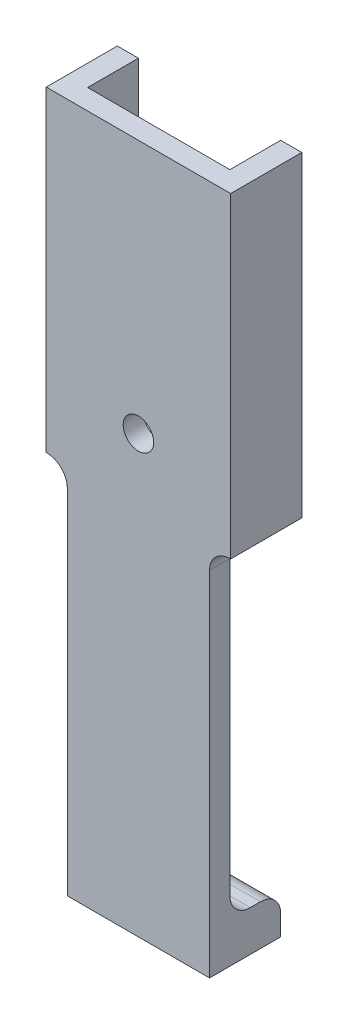
from build123d import *

# Parameters (mm, degrees)
SKETCH2_W                       = 14
SKETCH2_H                       = 31
SKETCH2_R                       = 1.5
SKETCH2_H_2                     = 36.9
BOSS_EXTRUDE1_DEPTH             = 2
SKETCH3_W                       = 14
SKETCH3_H                       = 4
BOSS_EXTRUDE2_DEPTH             = 5
SKETCH4_R                       = 1
CUT_EXTRUDE1_DEPTH              = 4
SKETCH5_W                       = 0.075
SKETCH5_H                       = 31
SKETCH5_H_2                     = 0.15
BOSS_EXTRUDE3_DEPTH             = 5
BOSS_EXTRUDE3_DIRECTION_2_REACH = 55.101
FILLET1_R                       = 2


with BuildPart() as part:
    # Sketch2 → Boss-Extrude1 (new body)
    # profile 1 of 3: a face of its own
    with BuildSketch(Plane.XY):
        Rectangle(SKETCH2_W, SKETCH2_H)
        with BuildLine():
            ThreePointArc((1.7, -9.5), (0, -11.2), (-1.7, -9.5))
            ThreePointArc((-1.7, -9.5), (0, -7.8), (1.7, -9.5))
        make_face(mode=Mode.SUBTRACT)
    # profile 2 of 3: a face of its own
    with BuildSketch(Plane.XY):
        with BuildLine():
            ThreePointArc((-1.7, -9.5), (0, -7.8), (1.7, -9.5))
            ThreePointArc((1.7, -9.5), (0, -11.2), (-1.7, -9.5))
        make_face()
        with Locations((0, -9.5)):
            Circle(SKETCH2_R, mode=Mode.SUBTRACT)
    # profile 3 of 3: a face of its own
    with BuildSketch(Plane.XY):
        with Locations((0, -33.95)):
            Rectangle(SKETCH2_W, SKETCH2_H_2)
    extrude(amount=BOSS_EXTRUDE1_DEPTH)

    # Sketch3 → Boss-Extrude2 (add)
    with BuildSketch(Plane(origin=(0, 0, 0), x_dir=(-1, 0, 0), z_dir=(0, 0, -1))):
        with Locations((0, -50.4)):
            Rectangle(SKETCH3_W, SKETCH3_H)
    extrude(amount=BOSS_EXTRUDE2_DEPTH)

    # Sketch4 → Cut-Extrude1 (cut)
    with BuildSketch(Plane.XZ.offset(52.4)):
        with Locations(Location((-3.5, -1.5, 0), (0, 0, 270))):
            Circle(SKETCH4_R)
        with Locations(Location((3.5, -1.5, 0), (0, 0, 270))):
            Circle(SKETCH4_R)
    extrude(amount=-CUT_EXTRUDE1_DEPTH, mode=Mode.SUBTRACT)

    # Sketch5 → Boss-Extrude3 (add)
    with BuildSketch(Plane(origin=(0, 0, 0), x_dir=(-1, 0, 0), z_dir=(0, 0, -1))):
        Polygon((-7.075, -15.65), (-7.075, -15.5), (-7.075, 15.5), (-9.075, 15.5), (-9.075, -15.65), align=None)
        Polygon((7.075, 15.5), (7.075, -15.5), (7.075, -15.65), (9.075, -15.65), (9.075, 15.5), align=None)
        with Locations((7.0375, 0)):
            Rectangle(SKETCH5_W, SKETCH5_H)
        with Locations((-7.0375, 0)):
            Rectangle(SKETCH5_W, SKETCH5_H)
        with Locations((-7.0375, -15.575)):
            Rectangle(SKETCH5_W, SKETCH5_H_2)
        with Locations((7.0375, -15.575)):
            Rectangle(SKETCH5_W, SKETCH5_H_2)
    extrude(amount=BOSS_EXTRUDE3_DEPTH)

    # Boss-Extrude3 direction 2: up to this face of the body (flat: up to its plane)
    boss_extrude3_direction_2_end = Plane(part.part.faces().sort_by_distance((0, -18.517050043, 2))[0])
    # Sketch5 → Boss-Extrude3 direction 2 (add, up to the picked face)
    with BuildSketch(Plane(origin=(0, 0, 0), x_dir=(-1, 0, 0), z_dir=(0, 0, -1)), mode=Mode.PRIVATE) as boss_extrude3_direction_2_sk1:
        Polygon((-7.075, -15.65), (-7.075, -15.5), (-7.075, 15.5), (-9.075, 15.5), (-9.075, -15.65), align=None)
    boss_extrude3_direction_2_tool1 = split(extrude(boss_extrude3_direction_2_sk1.sketch, amount=-BOSS_EXTRUDE3_DIRECTION_2_REACH, mode=Mode.PRIVATE), bisect_by=boss_extrude3_direction_2_end, keep=Keep.BOTH, mode=Mode.PRIVATE)
    # Sketch5 → Boss-Extrude3 direction 2 (add, up to the picked face)
    with BuildSketch(Plane(origin=(0, 0, 0), x_dir=(-1, 0, 0), z_dir=(0, 0, -1)), mode=Mode.PRIVATE) as boss_extrude3_direction_2_sk2:
        Polygon((7.075, 15.5), (7.075, -15.5), (7.075, -15.65), (9.075, -15.65), (9.075, 15.5), align=None)
    boss_extrude3_direction_2_tool2 = split(extrude(boss_extrude3_direction_2_sk2.sketch, amount=-BOSS_EXTRUDE3_DIRECTION_2_REACH, mode=Mode.PRIVATE), bisect_by=boss_extrude3_direction_2_end, keep=Keep.BOTH, mode=Mode.PRIVATE)
    # Sketch5 → Boss-Extrude3 direction 2 (add, up to the picked face)
    with BuildSketch(Plane(origin=(0, 0, 0), x_dir=(-1, 0, 0), z_dir=(0, 0, -1)), mode=Mode.PRIVATE) as boss_extrude3_direction_2_sk3:
        with Locations((7.0375, 0)):
            Rectangle(SKETCH5_W, SKETCH5_H)
    boss_extrude3_direction_2_tool3 = split(extrude(boss_extrude3_direction_2_sk3.sketch, amount=-BOSS_EXTRUDE3_DIRECTION_2_REACH, mode=Mode.PRIVATE), bisect_by=boss_extrude3_direction_2_end, keep=Keep.BOTH, mode=Mode.PRIVATE)
    # Sketch5 → Boss-Extrude3 direction 2 (add, up to the picked face)
    with BuildSketch(Plane(origin=(0, 0, 0), x_dir=(-1, 0, 0), z_dir=(0, 0, -1)), mode=Mode.PRIVATE) as boss_extrude3_direction_2_sk4:
        with Locations((-7.0375, 0)):
            Rectangle(SKETCH5_W, SKETCH5_H)
    boss_extrude3_direction_2_tool4 = split(extrude(boss_extrude3_direction_2_sk4.sketch, amount=-BOSS_EXTRUDE3_DIRECTION_2_REACH, mode=Mode.PRIVATE), bisect_by=boss_extrude3_direction_2_end, keep=Keep.BOTH, mode=Mode.PRIVATE)
    # Sketch5 → Boss-Extrude3 direction 2 (add, up to the picked face)
    with BuildSketch(Plane(origin=(0, 0, 0), x_dir=(-1, 0, 0), z_dir=(0, 0, -1)), mode=Mode.PRIVATE) as boss_extrude3_direction_2_sk5:
        with Locations((-7.0375, -15.575)):
            Rectangle(SKETCH5_W, SKETCH5_H_2)
    boss_extrude3_direction_2_tool5 = split(extrude(boss_extrude3_direction_2_sk5.sketch, amount=-BOSS_EXTRUDE3_DIRECTION_2_REACH, mode=Mode.PRIVATE), bisect_by=boss_extrude3_direction_2_end, keep=Keep.BOTH, mode=Mode.PRIVATE)
    # Sketch5 → Boss-Extrude3 direction 2 (add, up to the picked face)
    with BuildSketch(Plane(origin=(0, 0, 0), x_dir=(-1, 0, 0), z_dir=(0, 0, -1)), mode=Mode.PRIVATE) as boss_extrude3_direction_2_sk6:
        with Locations((7.0375, -15.575)):
            Rectangle(SKETCH5_W, SKETCH5_H_2)
    boss_extrude3_direction_2_tool6 = split(extrude(boss_extrude3_direction_2_sk6.sketch, amount=-BOSS_EXTRUDE3_DIRECTION_2_REACH, mode=Mode.PRIVATE), bisect_by=boss_extrude3_direction_2_end, keep=Keep.BOTH, mode=Mode.PRIVATE)
    add(boss_extrude3_direction_2_tool1.solids().sort_by(Axis((8.075, -0.075, 0), (0, 0, 1)))[0])
    add(boss_extrude3_direction_2_tool2.solids().sort_by(Axis((-8.075, -0.075, 0), (0, 0, 1)))[0])
    add(boss_extrude3_direction_2_tool3.solids().sort_by(Axis((-7.0375, 0, 0), (0, 0, 1)))[0])
    add(boss_extrude3_direction_2_tool4.solids().sort_by(Axis((7.0375, 0, 0), (0, 0, 1)))[0])
    add(boss_extrude3_direction_2_tool5.solids().sort_by(Axis((7.0375, -15.575, 0), (0, 0, 1)))[0])
    add(boss_extrude3_direction_2_tool6.solids().sort_by(Axis((-7.0375, -15.575, 0), (0, 0, 1)))[0])

    # Fillet1
    # the kernel refuses this fillet: 2 mm, written as the material it adds along each edge
    with BuildSketch(Plane(origin=(7, -48.4, 0), x_dir=(0, 0, -1), z_dir=(-1, 0, 0))) as fillet1_piece_1_section:
        with BuildLine():
            CenterArc((FILLET1_R, -FILLET1_R), FILLET1_R, 90, 90)
            Line((0, -FILLET1_R), (0, 0))
            Line((0, 0), (FILLET1_R, 0))
        make_face()
    fillet1_piece_1 = extrude(amount=14, mode=Mode.PRIVATE)
    fillet1_piece_1 = fillet1_piece_1 - Plane(origin=(-3.5, -47.93211331, -1.5), x_dir=(0, 0, -1), z_dir=(0, -1, 0)) * Cylinder(1, 37, mode=Mode.PRIVATE)
    fillet1_piece_1 = fillet1_piece_1 - Plane(origin=(3.5, -47.93211331, -1.5), x_dir=(0, 0, -1), z_dir=(0, -1, 0)) * Cylinder(1, 37, mode=Mode.PRIVATE)
    add(fillet1_piece_1)
    with BuildSketch(Plane(origin=(7, -15.65, 0), x_dir=(0, -1, 0), z_dir=(0, 0, 1)), Plane(origin=(-7, -15.65, 0), x_dir=(-1, 0, 0), z_dir=(0, 0, 1))) as fillet1_piece_2:
        with BuildLine():
            CenterArc((FILLET1_R, FILLET1_R), FILLET1_R, 180, 90)
            Line((0, FILLET1_R), (0, 0))
            Line((0, 0), (FILLET1_R, 0))
        make_face()
    extrude(amount=2)
    # the kernel refuses this fillet: 2 mm, written as the material it takes off along each edge
    with BuildSketch(Plane(origin=(12, -48.4, -5), x_dir=(0, 0, 1), z_dir=(-1, 0, 0))) as fillet1_2_piece_1:
        with BuildLine():
            CenterArc((FILLET1_R, -FILLET1_R), FILLET1_R, 90, 90)
            Line((0, -FILLET1_R), (0, 0))
            Line((0, 0), (FILLET1_R, 0))
        make_face()
    extrude(amount=24, mode=Mode.SUBTRACT)


solid = part.part
